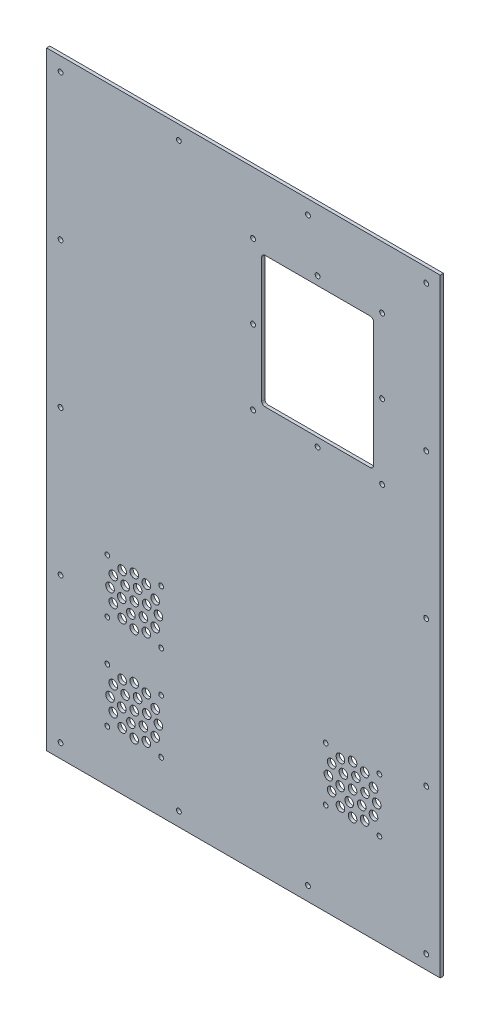
from build123d import *

# Parameters (mm, degrees)
SKETCH_1_W          = 366
SKETCH_1_H          = 566
EXTRUDE_1_DEPTH     = 3
SKETCH_5_R          = 2.25
CUT_EXTRUDE_2_DEPTH = 675.033381963
SKETCH_6_W          = 104
SKETCH_6_H          = 122
CUT_EXTRUDE_3_DEPTH = 675.033381963
SKETCH_7_R          = 2.25
CUT_EXTRUDE_4_DEPTH = 675.033381963
FILLET2_R           = 3
SKETCH_8_R          = 4
SKETCH_8_R_2        = 2.2
CUT_EXTRUDE_5_DEPTH = 675.033381963


with BuildPart() as part:
    # Эскиз1 → Бобышка-Вытянуть1 (new body)
    with BuildSketch(Plane.XY):
        with Locations((183, 283)):
            Rectangle(SKETCH_1_W, SKETCH_1_H)
    extrude(amount=EXTRUDE_1_DEPTH)

    # Эскиз5 → Вырез-Вытянуть2 (cut, through all)
    with BuildSketch(Plane(origin=(0, 0, 0), x_dir=(-1, 0, 0), z_dir=(0, 0, -1))):
        with Locations((-353, 553)):
            Circle(SKETCH_5_R)
        with Locations((-13, 553)):
            Circle(SKETCH_5_R)
        with Locations((-243, 553)):
            Circle(SKETCH_5_R)
        with Locations((-123, 553)):
            Circle(SKETCH_5_R)
        with Locations((-353, 418)):
            Circle(SKETCH_5_R)
        with Locations((-353, 283)):
            Circle(SKETCH_5_R)
        with Locations((-353, 148)):
            Circle(SKETCH_5_R)
        with Locations((-353, 13)):
            Circle(SKETCH_5_R)
        with Locations((-13, 418)):
            Circle(SKETCH_5_R)
        with Locations((-13, 283)):
            Circle(SKETCH_5_R)
        with Locations((-13, 148)):
            Circle(SKETCH_5_R)
        with Locations((-13, 13)):
            Circle(SKETCH_5_R)
        with Locations((-123, 13)):
            Circle(SKETCH_5_R)
        with Locations((-243, 13)):
            Circle(SKETCH_5_R)
    extrude(amount=-CUT_EXTRUDE_2_DEPTH, mode=Mode.SUBTRACT)

    # Эскиз6 → Вырез-Вытянуть3 (cut, through all)
    with BuildSketch(Plane.XY.offset(3)):
        with Locations((252, 439.5)):
            Rectangle(SKETCH_6_W, SKETCH_6_H)
    extrude(amount=-CUT_EXTRUDE_3_DEPTH, mode=Mode.SUBTRACT)

    # Эскиз7 → Вырез-Вытянуть4 (cut, through all)
    with BuildSketch(Plane.XY.offset(3)):
        with Locations((192, 370.5)):
            Circle(SKETCH_7_R)
        with Locations((192, 439.5)):
            Circle(SKETCH_7_R)
        with Locations((192, 508.5)):
            Circle(SKETCH_7_R)
        with Locations((252, 370.5)):
            Circle(SKETCH_7_R)
        with Locations((312, 370.5)):
            Circle(SKETCH_7_R)
        with Locations((252, 508.5)):
            Circle(SKETCH_7_R)
        with Locations((312, 508.5)):
            Circle(SKETCH_7_R)
        with Locations((312, 439.5)):
            Circle(SKETCH_7_R)
    extrude(amount=-CUT_EXTRUDE_4_DEPTH, mode=Mode.SUBTRACT)

    # Fillet2
    fillet2_edges = [part.edges().sort_by_distance(p)[0] for p in [
        (200, 378.5, 1.5),
        (304, 378.5, 1.5),
        (304, 500.5, 1.5),
        (200, 500.5, 1.5),
    ]]
    fillet(fillet2_edges, radius=FILLET2_R)

    # Эскиз8 → Вырез-Вытянуть5 (cut, through all)
    with BuildSketch(Plane(origin=(0, 0, 0), x_dir=(-1, 0, 0), z_dir=(0, 0, -1))):
        with Locations((-81.5, 138.5)):
            Circle(SKETCH_8_R)
        with Locations((-89.985281374, 152.514718626)):
            Circle(SKETCH_8_R)
        with Locations((-81.5, 161)):
            Circle(SKETCH_8_R)
        with Locations((-92.75, 141.514428415)):
            Circle(SKETCH_8_R)
        with Locations((-100.985571585, 149.75)):
            Circle(SKETCH_8_R)
        with Locations((-104, 161)):
            Circle(SKETCH_8_R)
        with Locations((-100.985571585, 172.25)):
            Circle(SKETCH_8_R)
        with Locations((-92.75, 180.485571585)):
            Circle(SKETCH_8_R)
        with Locations((-81.5, 183.5)):
            Circle(SKETCH_8_R)
        with Locations((-70.25, 180.485571585)):
            Circle(SKETCH_8_R)
        with Locations((-62.014428415, 172.25)):
            Circle(SKETCH_8_R)
        with Locations((-59, 161)):
            Circle(SKETCH_8_R)
        with Locations((-62.014428415, 149.75)):
            Circle(SKETCH_8_R)
        with Locations((-70.25, 141.514428415)):
            Circle(SKETCH_8_R)
        with Locations((-93.091109915, 164.105828541)):
            Circle(SKETCH_8_R)
        with Locations((-84.605828541, 172.591109915)):
            Circle(SKETCH_8_R)
        with Locations((-73.014718626, 169.485281374)):
            Circle(SKETCH_8_R)
        with Locations((-69.908890085, 157.894171459)):
            Circle(SKETCH_8_R)
        with Locations((-78.394171459, 149.408890085)):
            Circle(SKETCH_8_R)
        with Locations((-81.5, 73)):
            Circle(SKETCH_8_R)
        with Locations((-81.5, 50.5)):
            Circle(SKETCH_8_R)
        with Locations((-89.985281374, 64.514718626)):
            Circle(SKETCH_8_R)
        with Locations((-92.75, 53.514428415)):
            Circle(SKETCH_8_R)
        with Locations((-100.985571585, 61.75)):
            Circle(SKETCH_8_R)
        with Locations((-104, 73)):
            Circle(SKETCH_8_R)
        with Locations((-100.985571585, 84.25)):
            Circle(SKETCH_8_R)
        with Locations((-92.75, 92.485571585)):
            Circle(SKETCH_8_R)
        with Locations((-81.5, 95.5)):
            Circle(SKETCH_8_R)
        with Locations((-70.25, 92.485571585)):
            Circle(SKETCH_8_R)
        with Locations((-62.014428415, 84.25)):
            Circle(SKETCH_8_R)
        with Locations((-59, 73)):
            Circle(SKETCH_8_R)
        with Locations((-62.014428415, 61.75)):
            Circle(SKETCH_8_R)
        with Locations((-70.25, 53.514428415)):
            Circle(SKETCH_8_R)
        with Locations((-93.091109915, 76.105828541)):
            Circle(SKETCH_8_R)
        with Locations((-84.605828541, 84.591109915)):
            Circle(SKETCH_8_R)
        with Locations((-73.014718626, 81.485281374)):
            Circle(SKETCH_8_R)
        with Locations((-69.908890085, 69.894171459)):
            Circle(SKETCH_8_R)
        with Locations((-78.394171459, 61.408890085)):
            Circle(SKETCH_8_R)
        with Locations((-106.5, 186)):
            Circle(SKETCH_8_R_2)
        with Locations((-56.5, 186)):
            Circle(SKETCH_8_R_2)
        with Locations((-56.5, 136)):
            Circle(SKETCH_8_R_2)
        with Locations((-106.5, 136)):
            Circle(SKETCH_8_R_2)
        with Locations((-56.5, 98)):
            Circle(SKETCH_8_R_2)
        with Locations((-56.5, 48)):
            Circle(SKETCH_8_R_2)
        with Locations((-106.5, 48)):
            Circle(SKETCH_8_R_2)
        with Locations((-106.5, 98)):
            Circle(SKETCH_8_R_2)
        with Locations((-284.5, 111)):
            Circle(SKETCH_8_R)
        with Locations((-284.5, 88.5)):
            Circle(SKETCH_8_R)
        with Locations((-292.985281374, 102.514718626)):
            Circle(SKETCH_8_R)
        with Locations((-295.75, 91.514428415)):
            Circle(SKETCH_8_R)
        with Locations((-303.985571585, 99.75)):
            Circle(SKETCH_8_R)
        with Locations((-307, 111)):
            Circle(SKETCH_8_R)
        with Locations((-303.985571585, 122.25)):
            Circle(SKETCH_8_R)
        with Locations((-295.75, 130.485571585)):
            Circle(SKETCH_8_R)
        with Locations((-284.5, 133.5)):
            Circle(SKETCH_8_R)
        with Locations((-273.25, 130.485571585)):
            Circle(SKETCH_8_R)
        with Locations((-265.014428415, 122.25)):
            Circle(SKETCH_8_R)
        with Locations((-262, 111)):
            Circle(SKETCH_8_R)
        with Locations((-265.014428415, 99.75)):
            Circle(SKETCH_8_R)
        with Locations((-273.25, 91.514428415)):
            Circle(SKETCH_8_R)
        with Locations((-296.091109915, 114.105828541)):
            Circle(SKETCH_8_R)
        with Locations((-287.605828541, 122.591109915)):
            Circle(SKETCH_8_R)
        with Locations((-276.014718626, 119.485281374)):
            Circle(SKETCH_8_R)
        with Locations((-272.908890085, 107.894171459)):
            Circle(SKETCH_8_R)
        with Locations((-281.394171459, 99.408890085)):
            Circle(SKETCH_8_R)
        with Locations((-309.5, 136)):
            Circle(SKETCH_8_R_2)
        with Locations((-259.5, 136)):
            Circle(SKETCH_8_R_2)
        with Locations((-259.5, 86)):
            Circle(SKETCH_8_R_2)
        with Locations((-309.5, 86)):
            Circle(SKETCH_8_R_2)
    extrude(amount=-CUT_EXTRUDE_5_DEPTH, mode=Mode.SUBTRACT)


solid = part.part
